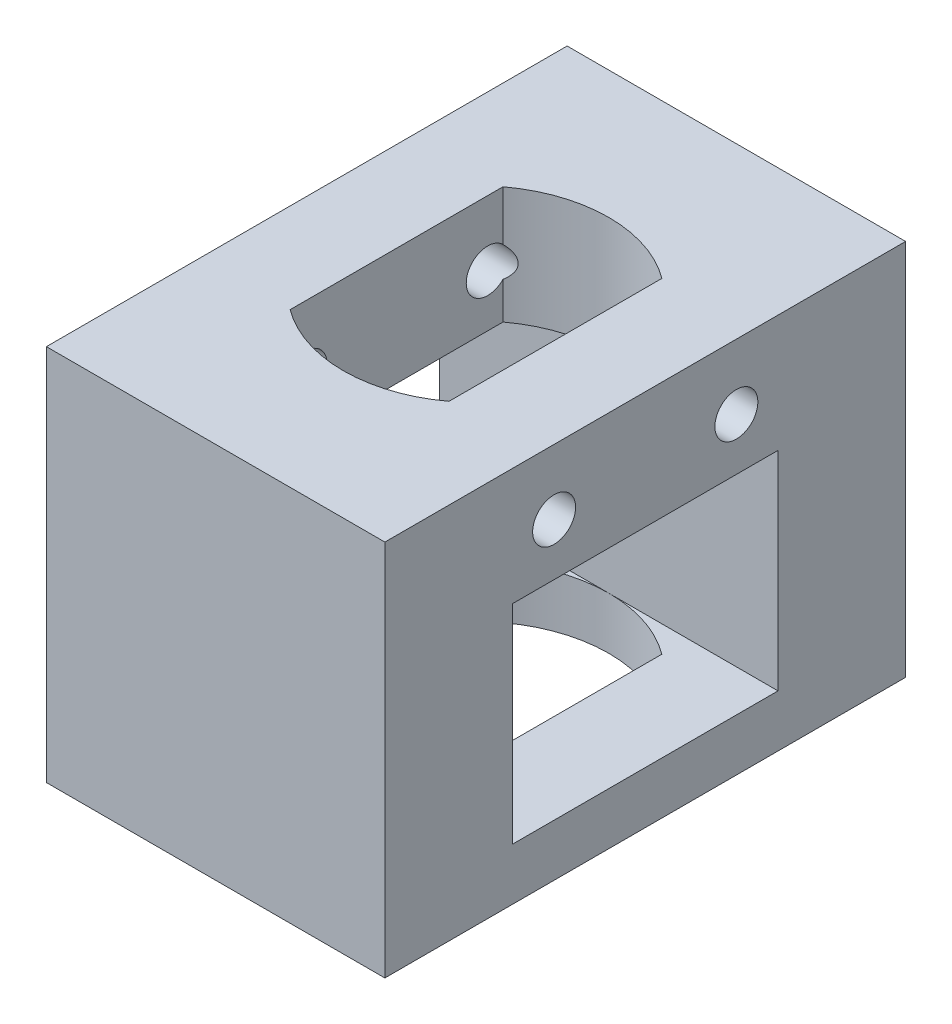
from build123d import *

# Parameters (mm, degrees)
SKETCH1_W               = 26
SKETCH1_H               = 40
BOSS_EXTRUDE1_DEPTH     = 29
CUT_EXTRUDE1_DEPTH      = 38.549966711
CUT_EXTRUDE1_DEPTH_BACK = 38.549966711
SKETCH2_W               = 20.4
SKETCH2_H               = 16
SKETCH2_R               = 1.65
SKETCH8_W               = 40
SKETCH8_H               = 9
SKETCH8_R               = 1.65
BOSS_EXTRUDE2_DEPTH     = 4


with BuildPart() as part:
    # Sketch1 → Boss-Extrude1 (new body)
    with BuildSketch(Plane(origin=(0, 0, 0), x_dir=(1, 0, 0), z_dir=(0, 1, 0))):
        Rectangle(SKETCH1_W, SKETCH1_H)
        with BuildLine():
            ThreePointArc((-6.1, 8.174961774), (0, 10.2), (6.1, 8.174961774))
            Line((6.1, 8.174961774), (6.1, -8.174961774))
            ThreePointArc((6.1, -8.174961774), (0, -10.2), (-6.1, -8.174961774))
            Line((-6.1, -8.174961774), (-6.1, 8.174961774))
        make_face(mode=Mode.SUBTRACT)
    extrude(amount=-BOSS_EXTRUDE1_DEPTH)

    # Sketch2 → Cut-Extrude1 (cut, two sides: drawn at the far end of the back side and taken through both)
    with BuildSketch(Plane(origin=(0, 0, 0), x_dir=(0, 0, -1), z_dir=(1, 0, 0)).offset(-CUT_EXTRUDE1_DEPTH_BACK)):
        with Locations((0, -17)):
            Rectangle(SKETCH2_W, SKETCH2_H)
        with Locations((7, -5)):
            Circle(SKETCH2_R)
        with Locations((-7, -5)):
            Circle(SKETCH2_R)
    extrude(amount=CUT_EXTRUDE1_DEPTH + CUT_EXTRUDE1_DEPTH_BACK, mode=Mode.SUBTRACT)

    # Sketch8 → Boss-Extrude2 (add)
    with BuildSketch(Plane.ZY.offset(-6.1)):
        with Locations((0, -4.5)):
            Rectangle(SKETCH8_W, SKETCH8_H)
        with Locations((7, -5)):
            Circle(SKETCH8_R, mode=Mode.SUBTRACT)
        with Locations((-7, -5)):
            Circle(SKETCH8_R, mode=Mode.SUBTRACT)
    extrude(amount=-BOSS_EXTRUDE2_DEPTH)


solid = part.part
